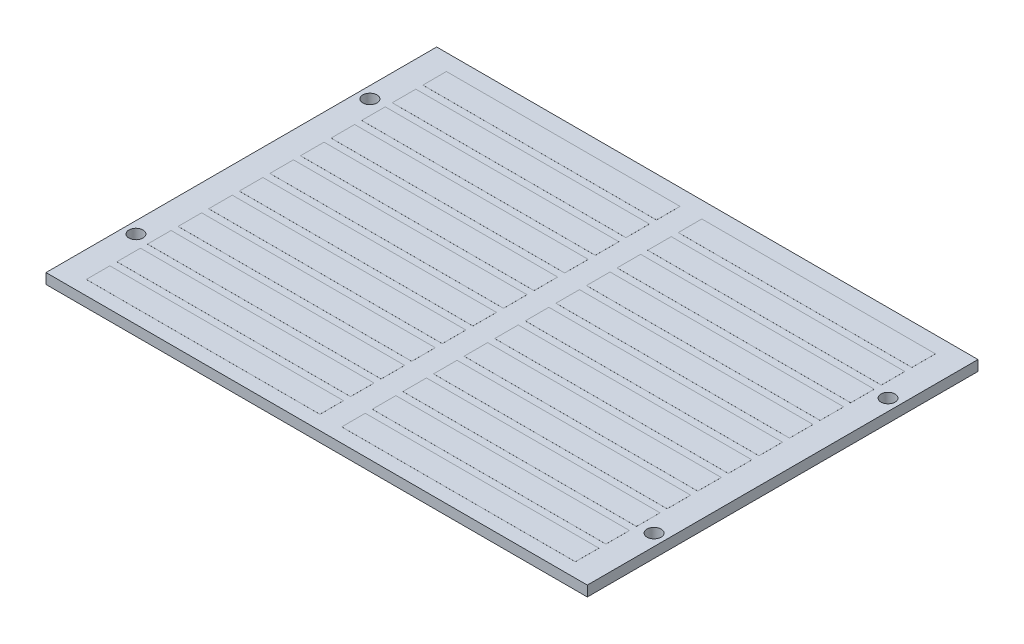
from build123d import *

# Parameters (mm, degrees)
SKETCH_1_W                = 115
SKETCH_1_H                = 83
EXTRUDE_1_DEPTH           = 2.2
SKETCH_2_W                = 49.628548445
SKETCH_2_H                = 5
EXTRUDE_2_DEPTH           = 0.01
PATTERN_LINEAR_1_COUNT    = 12
PATTERN_LINEAR_1_PITCH    = 6.5
MIRROR_1_COPY_1_SKETCH_W  = 49.628548445
MIRROR_1_COPY_1_SKETCH_H  = 5
MIRROR_1_COPY_1_DEPTH     = 0.01
MIRROR_1_COPY_2_SKETCH_W  = 49.628548445
MIRROR_1_COPY_2_SKETCH_H  = 5
MIRROR_1_COPY_2_DEPTH     = 0.01
MIRROR_1_COPY_3_SKETCH_W  = 49.628548445
MIRROR_1_COPY_3_SKETCH_H  = 5
MIRROR_1_COPY_3_DEPTH     = 0.01
MIRROR_1_COPY_4_SKETCH_W  = 49.628548445
MIRROR_1_COPY_4_SKETCH_H  = 5
MIRROR_1_COPY_4_DEPTH     = 0.01
MIRROR_1_COPY_5_SKETCH_W  = 49.628548445
MIRROR_1_COPY_5_SKETCH_H  = 5
MIRROR_1_COPY_5_DEPTH     = 0.01
MIRROR_1_COPY_6_SKETCH_W  = 49.628548445
MIRROR_1_COPY_6_SKETCH_H  = 5
MIRROR_1_COPY_6_DEPTH     = 0.01
MIRROR_1_COPY_7_SKETCH_W  = 49.628548445
MIRROR_1_COPY_7_SKETCH_H  = 5
MIRROR_1_COPY_7_DEPTH     = 0.01
MIRROR_1_COPY_8_SKETCH_W  = 49.628548445
MIRROR_1_COPY_8_SKETCH_H  = 5
MIRROR_1_COPY_8_DEPTH     = 0.01
MIRROR_1_COPY_9_SKETCH_W  = 49.628548445
MIRROR_1_COPY_9_SKETCH_H  = 5
MIRROR_1_COPY_9_DEPTH     = 0.01
MIRROR_1_COPY_10_SKETCH_W = 49.628548445
MIRROR_1_COPY_10_SKETCH_H = 5
MIRROR_1_COPY_10_DEPTH    = 0.01
MIRROR_1_COPY_11_SKETCH_W = 49.628548445
MIRROR_1_COPY_11_SKETCH_H = 5
MIRROR_1_COPY_11_DEPTH    = 0.01
MIRROR_1_COPY_12_SKETCH_W = 49.628548445
MIRROR_1_COPY_12_SKETCH_H = 5
MIRROR_1_COPY_12_DEPTH    = 0.01
SKETCH_3_R                = 1.5
CUT_EXTRUDE_1_DEPTH       = 10
MIRROR_3_COPY_1_SKETCH_R  = 1.5
MIRROR_3_COPY_1_DEPTH     = 10


with BuildPart() as part:
    # Эскиз1 → Бобышка-Вытянуть1 (new body)
    with BuildSketch(Plane(origin=(0, 0, 0), x_dir=(1, 0, 0), z_dir=(0, 1, 0))):
        Rectangle(SKETCH_1_W, SKETCH_1_H)
    extrude(amount=EXTRUDE_1_DEPTH)

    # Эскиз2 → Бобышка-Вытянуть2 (add)
    with BuildSketch(Plane(origin=(0, 2.2, 0), x_dir=(1, 0, 0), z_dir=(0, 1, 0))):
        with Locations((27.130748896, -35.988250825)):
            Rectangle(SKETCH_2_W, SKETCH_2_H)
    extrude_2 = extrude(amount=EXTRUDE_2_DEPTH)

    # Линейный массив1: Бобышка-Вытянуть2 ×12
    with Locations(*[(0, 0, -i * PATTERN_LINEAR_1_PITCH) for i in range(1, PATTERN_LINEAR_1_COUNT)]):
        add(extrude_2)

    # Зеркальное отражение1 copy 1 sketch → Зеркальное отражение1 copy 1 (add)
    with BuildSketch(Plane(origin=(0, 2.2, -6.5), x_dir=(-1, 0, 0), z_dir=(0, 1, 0))):
        with Locations((27.130748896, 35.988250825)):
            Rectangle(MIRROR_1_COPY_1_SKETCH_W, MIRROR_1_COPY_1_SKETCH_H)
    extrude(amount=MIRROR_1_COPY_1_DEPTH)

    # Зеркальное отражение1 copy 2 sketch → Зеркальное отражение1 copy 2 (add)
    with BuildSketch(Plane(origin=(0, 2.2, -13), x_dir=(-1, 0, 0), z_dir=(0, 1, 0))):
        with Locations((27.130748896, 35.988250825)):
            Rectangle(MIRROR_1_COPY_2_SKETCH_W, MIRROR_1_COPY_2_SKETCH_H)
    extrude(amount=MIRROR_1_COPY_2_DEPTH)

    # Зеркальное отражение1 copy 3 sketch → Зеркальное отражение1 copy 3 (add)
    with BuildSketch(Plane(origin=(0, 2.2, -19.5), x_dir=(-1, 0, 0), z_dir=(0, 1, 0))):
        with Locations((27.130748896, 35.988250825)):
            Rectangle(MIRROR_1_COPY_3_SKETCH_W, MIRROR_1_COPY_3_SKETCH_H)
    extrude(amount=MIRROR_1_COPY_3_DEPTH)

    # Зеркальное отражение1 copy 4 sketch → Зеркальное отражение1 copy 4 (add)
    with BuildSketch(Plane(origin=(0, 2.2, -26), x_dir=(-1, 0, 0), z_dir=(0, 1, 0))):
        with Locations((27.130748896, 35.988250825)):
            Rectangle(MIRROR_1_COPY_4_SKETCH_W, MIRROR_1_COPY_4_SKETCH_H)
    extrude(amount=MIRROR_1_COPY_4_DEPTH)

    # Зеркальное отражение1 copy 5 sketch → Зеркальное отражение1 copy 5 (add)
    with BuildSketch(Plane(origin=(0, 2.2, -32.5), x_dir=(-1, 0, 0), z_dir=(0, 1, 0))):
        with Locations((27.130748896, 35.988250825)):
            Rectangle(MIRROR_1_COPY_5_SKETCH_W, MIRROR_1_COPY_5_SKETCH_H)
    extrude(amount=MIRROR_1_COPY_5_DEPTH)

    # Зеркальное отражение1 copy 6 sketch → Зеркальное отражение1 copy 6 (add)
    with BuildSketch(Plane(origin=(0, 2.2, -39), x_dir=(-1, 0, 0), z_dir=(0, 1, 0))):
        with Locations((27.130748896, 35.988250825)):
            Rectangle(MIRROR_1_COPY_6_SKETCH_W, MIRROR_1_COPY_6_SKETCH_H)
    extrude(amount=MIRROR_1_COPY_6_DEPTH)

    # Зеркальное отражение1 copy 7 sketch → Зеркальное отражение1 copy 7 (add)
    with BuildSketch(Plane(origin=(0, 2.2, -45.5), x_dir=(-1, 0, 0), z_dir=(0, 1, 0))):
        with Locations((27.130748896, 35.988250825)):
            Rectangle(MIRROR_1_COPY_7_SKETCH_W, MIRROR_1_COPY_7_SKETCH_H)
    extrude(amount=MIRROR_1_COPY_7_DEPTH)

    # Зеркальное отражение1 copy 8 sketch → Зеркальное отражение1 copy 8 (add)
    with BuildSketch(Plane(origin=(0, 2.2, -52), x_dir=(-1, 0, 0), z_dir=(0, 1, 0))):
        with Locations((27.130748896, 35.988250825)):
            Rectangle(MIRROR_1_COPY_8_SKETCH_W, MIRROR_1_COPY_8_SKETCH_H)
    extrude(amount=MIRROR_1_COPY_8_DEPTH)

    # Зеркальное отражение1 copy 9 sketch → Зеркальное отражение1 copy 9 (add)
    with BuildSketch(Plane(origin=(0, 2.2, -58.5), x_dir=(-1, 0, 0), z_dir=(0, 1, 0))):
        with Locations((27.130748896, 35.988250825)):
            Rectangle(MIRROR_1_COPY_9_SKETCH_W, MIRROR_1_COPY_9_SKETCH_H)
    extrude(amount=MIRROR_1_COPY_9_DEPTH)

    # Зеркальное отражение1 copy 10 sketch → Зеркальное отражение1 copy 10 (add)
    with BuildSketch(Plane(origin=(0, 2.2, -65), x_dir=(-1, 0, 0), z_dir=(0, 1, 0))):
        with Locations((27.130748896, 35.988250825)):
            Rectangle(MIRROR_1_COPY_10_SKETCH_W, MIRROR_1_COPY_10_SKETCH_H)
    extrude(amount=MIRROR_1_COPY_10_DEPTH)

    # Зеркальное отражение1 copy 11 sketch → Зеркальное отражение1 copy 11 (add)
    with BuildSketch(Plane(origin=(0, 2.2, -71.5), x_dir=(-1, 0, 0), z_dir=(0, 1, 0))):
        with Locations((27.130748896, 35.988250825)):
            Rectangle(MIRROR_1_COPY_11_SKETCH_W, MIRROR_1_COPY_11_SKETCH_H)
    extrude(amount=MIRROR_1_COPY_11_DEPTH)

    # Зеркальное отражение1 copy 12 sketch → Зеркальное отражение1 copy 12 (add)
    with BuildSketch(Plane(origin=(0, 2.2, 0), x_dir=(-1, 0, 0), z_dir=(0, 1, 0))):
        with Locations((27.130748896, 35.988250825)):
            Rectangle(MIRROR_1_COPY_12_SKETCH_W, MIRROR_1_COPY_12_SKETCH_H)
    extrude(amount=MIRROR_1_COPY_12_DEPTH)

    # Эскиз3 → Вырез-Вытянуть1 (cut)
    with BuildSketch(Plane(origin=(0, 2.2, 0), x_dir=(1, 0, 0), z_dir=(0, 1, 0))):
        with Locations((55.033284514, 24.849599851)):
            Circle(SKETCH_3_R)
    cut_extrude_1 = extrude(amount=-CUT_EXTRUDE_1_DEPTH, mode=Mode.SUBTRACT)

    # Зеркальное отражение2: Вырез-Вытянуть1 across plane
    add(cut_extrude_1.mirror(Plane(origin=(0, 0, 0), x_dir=(1, 0, 0), z_dir=(0, 0, -1))), mode=Mode.SUBTRACT)

    # Зеркальное отражение3: Вырез-Вытянуть1 across plane
    add(cut_extrude_1.mirror(Plane(origin=(0, 0, 0), x_dir=(0, 0, 1), z_dir=(1, 0, 0))), mode=Mode.SUBTRACT)

    # Зеркальное отражение3 copy 1 sketch → Зеркальное отражение3 copy 1 (cut)
    with BuildSketch(Plane(origin=(0, 2.2, 0), x_dir=(-1, 0, 0), z_dir=(0, 1, 0))):
        with Locations((55.033284514, 24.849599851)):
            Circle(MIRROR_3_COPY_1_SKETCH_R)
    extrude(amount=-MIRROR_3_COPY_1_DEPTH, mode=Mode.SUBTRACT)


solid = part.part
